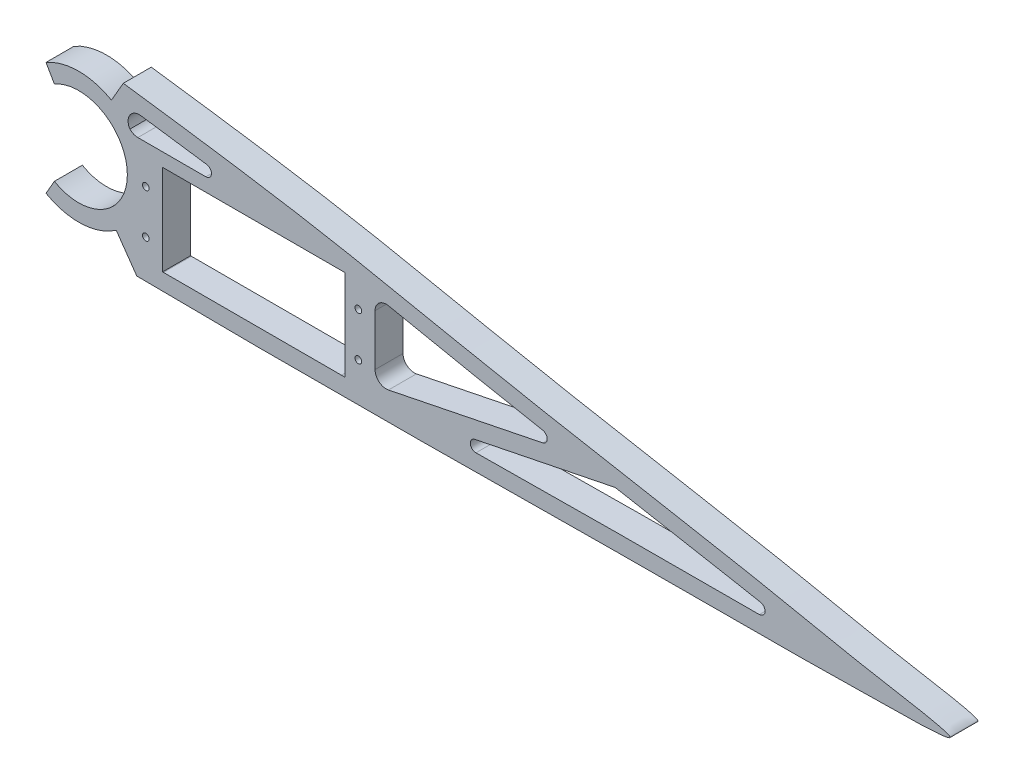
from build123d import *

# Parameters (mm, degrees)
STOCK_SERVORIB_1_OUTLINE_R = 0.762
STOCK_SERVORIB_1_DEPTH     = 6.35
CUT_EXTRUDE1_DEPTH         = 358.353404623
CUT_EXTRUDE1_DEPTH_BACK    = 358.353404623
SKETCH1_W                  = 41.402
SKETCH1_H                  = 20.574


# Read off the part's stored shape, not the designer's step: Stock-servoRib-1
with BuildPart() as part:
    # Stock-servoRib-1 outline → Stock-servoRib-1 (new body)
    with BuildSketch(Plane.XY):
        with BuildLine():
            ThreePointArc((150.262745111, 4.359896187), (158.340385588, 2.383310137), (166.215017379, 5.056387436))
            Line((166.215017379, 5.056387436), (170.885986206, -1.614447384))
            add(Edge.make_bspline(
                [(170.885986206, -1.614447384), (173.199248024, -1.643892858), (187.361238099, -1.81458899), (213.348366866, -1.891348793), (249.080086593, -1.721550605), (283.988321232, -1.250472189), (315.634817831, -1.397476336), (335.235128281, -1.000194328), (355.460930634, -0.840027996), (355.6, 0), (355.742662776, 0.861733457), (335.067988759, 4.1778995), (315.595899257, 8.512300522), (283.755747478, 14.215036766), (248.711891199, 20.622850241), (213.099276813, 28.296086976), (186.082841068, 32.263799949), (170.993744232, 34.347353391), (167.818229232, 34.766886636)],
                knots=[0.746711554, 0.746711554, 0.746711554, 0.746711554, 0.756228363, 0.804980995, 0.853733783, 0.902478123, 0.951230531, 0.975604078, 1, 1, 1, 1.025026287, 1.049952062, 1.09968381, 1.149415558, 1.199258544, 1.248703056, 1.26186923, 1.26186923, 1.26186923, 1.26186923], degree=3))
            Line((167.818229232, 34.766886636), (165.121745111, 30.096439137))
            ThreePointArc((165.121745111, 30.096439137), (157.692245111, 32.087167662), (150.262745111, 30.096439137))
            Line((150.262745111, 30.096439137), (152.167745111, 26.796882348))
            ThreePointArc((152.167745111, 26.796882348), (168.741245111, 17.228167662), (152.167745111, 7.659452975))
            Line((152.167745111, 7.659452975), (150.262745111, 4.359896187))
        make_face()
        with Locations((172.932245111, 7.06603781)):
            Circle(STOCK_SERVORIB_1_OUTLINE_R, mode=Mode.SUBTRACT)
        with Locations((221.192245111, 7.06603781)):
            Circle(STOCK_SERVORIB_1_OUTLINE_R, mode=Mode.SUBTRACT)
        with BuildLine():
            add(Edge.make_bspline(
                [(176.742245111, 2.127871401), (176.805954996, 2.127158331), (176.869664392, 2.126447125), (176.933373308, 2.12573781)],
                knots=[0.754687473, 0.754687473, 0.754687473, 0.754687473, 0.754949971, 0.754949971, 0.754949971, 0.754949971], degree=3))
            Line((176.742245111, 2.127871401), (176.742245111, 21.93773781))
            Line((176.742245111, 21.93773781), (217.382245111, 21.93773781))
            Line((217.382245111, 21.93773781), (217.382245111, 2.12573781))
            Line((217.382245111, 2.12573781), (176.933373308, 2.12573781))
        make_face(mode=Mode.SUBTRACT)
        with BuildLine():
            add(Edge.make_bspline(
                [(263.07680528, 14.161020864), (261.14095691, 14.524621095), (255.900715298, 15.517708009), (244.253344191, 17.790920601), (234.484880124, 19.828530803), (228.043168282, 21.124375321)],
                knots=[0.128085016, 0.128085016, 0.128085016, 0.128085016, 0.136223927, 0.150158625, 0.177211028, 0.177211028, 0.177211028, 0.177211028], degree=3))
            ThreePointArc((263.07680528, 14.161020864), (264.112333152, 12.922156698), (263.095079652, 11.668243737))
            Line((263.095079652, 11.668243737), (228.047669861, 4.551986861))
            ThreePointArc((228.047669861, 4.551986861), (225.934790425, 5.074548517), (225.002245111, 7.041192723))
            Line((225.002245111, 7.041192723), (225.002245111, 18.634259666))
            ThreePointArc((225.002245111, 18.634259666), (225.933013129, 20.599449842), (228.043168282, 21.124375321))
        make_face(mode=Mode.SUBTRACT)
        with BuildLine():
            add(Edge.make_bspline(
                [(307.914136939, 5.935312644), (307.086314647, 6.092530193), (305.437659795, 6.40375302), (302.080460727, 7.030924714), (296.128740394, 8.128009503), (288.419095057, 9.523263407), (282.514007949, 10.590419297), (280.046844381, 11.037863271)],
                knots=[0.066550439, 0.066550439, 0.066550439, 0.066550439, 0.070034113, 0.073517787, 0.080485136, 0.094419834, 0.104540596, 0.104540596, 0.104540596, 0.104540596], degree=3))
            Line((307.914136939, 5.935312644), (312.686679826, 5.028925484))
            ThreePointArc((312.686679826, 5.028925484), (313.583996909, 3.633078161), (312.334547907, 2.541086912))
            Line((312.334547907, 2.541086912), (312.366700518, 2.500769979))
            add(Edge.make_bspline(
                [(247.917063632, 2.130465271), (253.320223226, 2.179172311), (262.053928383, 2.27290524), (274.243786646, 2.392810404), (284.557207321, 2.460830336), (295.114568038, 2.476111574), (303.821788904, 2.477788664), (309.500555419, 2.48977995), (311.76110017, 2.498201702), (312.366700518, 2.500769979)],
                knots=[0.852366894, 0.852366894, 0.852366894, 0.852366894, 0.87476291, 0.888697608, 0.902632305, 0.916567003, 0.930501701, 0.93746905, 0.940041303, 0.940041303, 0.940041303, 0.940041303], degree=3))
            ThreePointArc((247.917063632, 2.130465271), (246.642566048, 3.267726916), (247.652903247, 4.645016604))
            Line((247.652903247, 4.645016604), (279.088159917, 11.027838124))
            ThreePointArc((279.088159917, 11.027838124), (279.567024855, 11.078493396), (280.046844381, 11.037863271))
        make_face(mode=Mode.SUBTRACT)
        with Locations((172.932245111, 16.99743781)):
            Circle(STOCK_SERVORIB_1_OUTLINE_R, mode=Mode.SUBTRACT)
        with Locations((221.192245111, 16.99743781)):
            Circle(STOCK_SERVORIB_1_OUTLINE_R, mode=Mode.SUBTRACT)
        with BuildLine():
            add(Edge.make_bspline(
                [(186.761545389, 28.274256519), (181.779821471, 29.005964346), (176.785071225, 29.71618456), (171.794127224, 30.392455812)],
                knots=[0.234888898, 0.234888898, 0.234888898, 0.234888898, 0.255659464, 0.255659464, 0.255659464, 0.255659464], degree=3))
            ThreePointArc((186.761545389, 28.274256519), (187.843615077, 26.925214192), (186.576989884, 25.74773781))
            Line((186.576989884, 25.74773781), (171.123965371, 25.74773781))
            ThreePointArc((171.123965371, 25.74773781), (170.142940883, 25.94483556), (169.314166567, 26.505540209))
            ThreePointArc((169.314166567, 26.505540209), (169.311790184, 29.241656273), (171.794127224, 30.392455812))
        make_face(mode=Mode.SUBTRACT)
    extrude(amount=STOCK_SERVORIB_1_DEPTH)

    # Sketch1 → Cut-Extrude1 (cut, two sides: drawn at the far end of the back side and taken through both)
    with BuildSketch(Plane.XY.offset(6.35).offset(-CUT_EXTRUDE1_DEPTH_BACK)):
        with Locations((197.443245111, 12.414871401)):
            Rectangle(SKETCH1_W, SKETCH1_H)
    extrude(amount=CUT_EXTRUDE1_DEPTH + CUT_EXTRUDE1_DEPTH_BACK, mode=Mode.SUBTRACT)


solid = part.part
